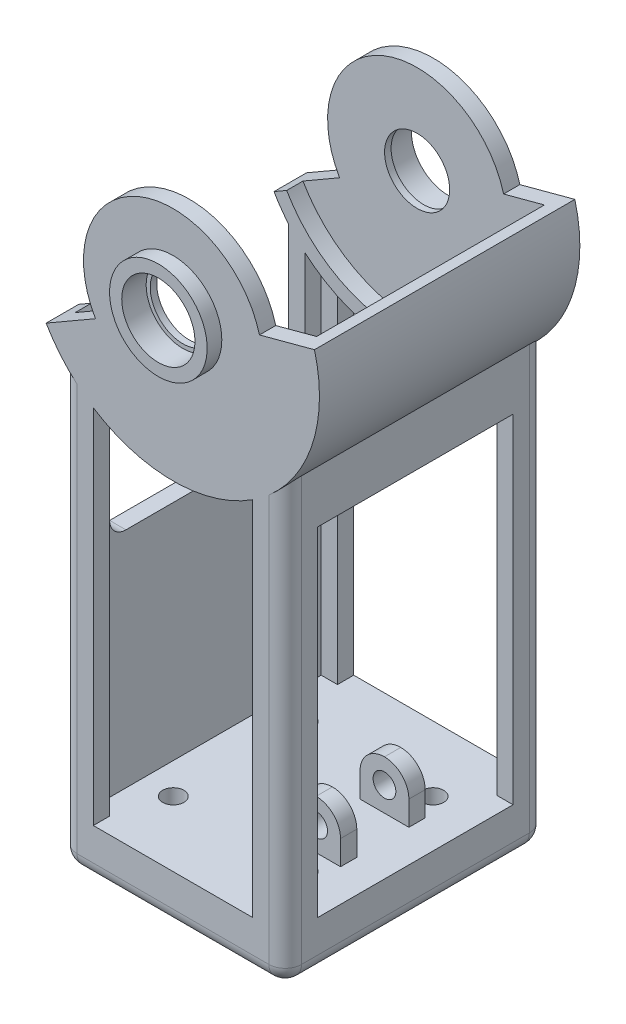
from build123d import *

# Parameters (mm, degrees)
SKETCH1_R               = 45
BOSS_EXTRUDE1_DEPTH     = 80
SKETCH2_W               = 68.94399988
SKETCH2_H               = 120
BOSS_EXTRUDE2_DEPTH     = 80
CUT_EXTRUDE1_START      = -70
SKETCH3_R               = 40.5
CUT_EXTRUDE1_DEPTH      = 70
CUT_EXTRUDE2_REACH      = 176.939
SKETCH4_R               = 10
CUT_EXTRUDE3_REACH      = 176.939
CUT_EXTRUDE4_REACH      = 200.874
CUT_EXTRUDE4_END_RADIUS = 45
SKETCH6_W               = 58.94399988
SKETCH6_H               = 70
CUT_EXTRUDE5_REACH      = 200.874
CUT_EXTRUDE5_END_RADIUS = 45
SKETCH7_W               = 48.94399988
SKETCH7_H               = 5
CUT_EXTRUDE6_START      = -103.925442
SKETCH8_W               = 5
SKETCH8_H               = 60
CUT_EXTRUDE6_DEPTH      = 103.925442
SKETCH9_W               = 65
SKETCH9_H               = 60
CUT_EXTRUDE7_DEPTH      = 60
SKETCH11_W              = 68.94399988
SKETCH11_H              = 80
BOSS_EXTRUDE3_DEPTH     = 15
SKETCH12_W              = 15
SKETCH12_H              = 5
BOSS_EXTRUDE4_DEPTH     = 15
FILLET1_R               = 7.5
CUT_EXTRUDE8_REACH      = 180.061
SKETCH13_R              = 3.5
FILLET2_R               = 5
FILLET3_R               = 5
SKETCH15_R              = 15
BOSS_EXTRUDE5_DEPTH     = 4.5
SKETCH16_R              = 11.25
CUT_EXTRUDE9_DEPTH      = 7.5
SKETCH17_R              = 3.25
CUT_EXTRUDE10_DEPTH     = 15


with BuildPart() as part:
    # Sketch1 → Boss-Extrude1 (new body)
    with BuildSketch(Plane.XY):
        Circle(SKETCH1_R)
    extrude(amount=BOSS_EXTRUDE1_DEPTH)

    # Sketch2 → Boss-Extrude2 (add)
    with BuildSketch(Plane(origin=(0, 0, 0), x_dir=(-1, 0, 0), z_dir=(0, 0, -1))):
        with Locations((0, -88.925442436)):
            Rectangle(SKETCH2_W, SKETCH2_H)
    extrude(amount=-BOSS_EXTRUDE2_DEPTH)

    # Sketch3 → Cut-Extrude1 (cut)
    with BuildSketch(Plane(origin=(0, 0, 5), x_dir=(-1, 0, 0), z_dir=(0, 0, -1)).offset(CUT_EXTRUDE1_START)):
        Circle(SKETCH3_R)
    extrude(amount=CUT_EXTRUDE1_DEPTH, mode=Mode.SUBTRACT)

    # Cut-Extrude2: up to this face of the body (flat: up to its plane)
    cut_extrude2_end = Plane(part.part.faces().sort_by_distance((0, -51.092470511, 80))[0])
    # Sketch4 → Cut-Extrude2 (cut, up to the picked face)
    with BuildSketch(Plane(origin=(0, 0, 0), x_dir=(-1, 0, 0), z_dir=(0, 0, -1)), mode=Mode.PRIVATE) as cut_extrude2_sk1:
        Circle(SKETCH4_R)
    cut_extrude2_tool1 = split(extrude(cut_extrude2_sk1.sketch, amount=-CUT_EXTRUDE2_REACH, mode=Mode.PRIVATE), bisect_by=cut_extrude2_end, keep=Keep.BOTH, mode=Mode.PRIVATE)
    add(cut_extrude2_tool1.solids().sort_by(Axis((0, 0, 0), (0, 0, 1)))[0], mode=Mode.SUBTRACT)

    # Cut-Extrude3: up to this face of the body (flat: up to its plane)
    cut_extrude3_end = Plane(part.part.faces().sort_by_distance((0, -52.276987432, 80))[0])
    # Sketch5 → Cut-Extrude3 (cut, up to the picked face)
    with BuildSketch(Plane(origin=(0, 0, 0), x_dir=(-1, 0, 0), z_dir=(0, 0, -1)), mode=Mode.PRIVATE) as cut_extrude3_sk1:
        with BuildLine():
            Line((-26.562960223, 7.11752374), (-43.466662183, 11.64685703))
            ThreePointArc((-43.466662183, 11.64685703), (17.220754456, 41.574578963), (38.97114317, -22.5))
            Line((38.97114317, -22.5), (23.815698604, -13.75))
            ThreePointArc((23.815698604, -13.75), (10.52379439, 25.406687144), (-26.562960223, 7.11752374))
        make_face()
    cut_extrude3_tool1 = split(extrude(cut_extrude3_sk1.sketch, amount=-CUT_EXTRUDE3_REACH, mode=Mode.PRIVATE), bisect_by=cut_extrude3_end, keep=Keep.BOTH, mode=Mode.PRIVATE)
    add(cut_extrude3_tool1.solids().sort_by(Axis((-31.949807, -17.161312, 0), (0, 0, 1)))[0], mode=Mode.SUBTRACT)

    # Cut-Extrude4: up to this cylinder (the profile starts outside it)
    cut_extrude4_end = Plane(origin=(0, 0, 40), z_dir=(0, 0, -1)) * Cylinder(CUT_EXTRUDE4_END_RADIUS, 492.748, mode=Mode.PRIVATE)
    # Sketch6 → Cut-Extrude4 (cut, up to the surface)
    with BuildSketch(Plane.XZ.offset(148.925442436), mode=Mode.PRIVATE) as cut_extrude4_sk1:
        with Locations((0, 40)):
            Rectangle(SKETCH6_W, SKETCH6_H)
    cut_extrude4_tool1 = extrude(cut_extrude4_sk1.sketch, amount=-CUT_EXTRUDE4_REACH, mode=Mode.PRIVATE) - cut_extrude4_end
    add(cut_extrude4_tool1.solids().sort_by_distance((0, -148.925442, 40))[0], mode=Mode.SUBTRACT)

    # Cut-Extrude5: up to this cylinder (the profile starts outside it)
    cut_extrude5_end = Plane(origin=(0, 0, 40), z_dir=(0, 0, -1)) * Cylinder(CUT_EXTRUDE5_END_RADIUS, 567.748, mode=Mode.PRIVATE)
    # Sketch7 → Cut-Extrude5 (cut, up to the surface)
    with BuildSketch(Plane.XZ.offset(148.925442436), mode=Mode.PRIVATE) as cut_extrude5_sk1:
        with Locations((0, 77.5)):
            Rectangle(SKETCH7_W, SKETCH7_H)
    cut_extrude5_tool1 = extrude(cut_extrude5_sk1.sketch, amount=-CUT_EXTRUDE5_REACH, mode=Mode.PRIVATE) - cut_extrude5_end
    add(cut_extrude5_tool1.solids().sort_by_distance((0, -148.925442, 77.5))[0], mode=Mode.SUBTRACT)
    # Sketch7 → Cut-Extrude5 (cut, up to the surface)
    with BuildSketch(Plane.XZ.offset(148.925442436), mode=Mode.PRIVATE) as cut_extrude5_sk2:
        with Locations((0, 2.5)):
            Rectangle(SKETCH7_W, SKETCH7_H)
    cut_extrude5_tool2 = extrude(cut_extrude5_sk2.sketch, amount=-CUT_EXTRUDE5_REACH, mode=Mode.PRIVATE) - cut_extrude5_end
    add(cut_extrude5_tool2.solids().sort_by_distance((0, -148.925442, 2.5))[0], mode=Mode.SUBTRACT)

    # Sketch8 → Cut-Extrude6 (cut)
    with BuildSketch(Plane.XZ.offset(148.925442436).offset(CUT_EXTRUDE6_START)):
        with Locations((31.97199994, 40)):
            Rectangle(SKETCH8_W, SKETCH8_H)
    extrude(amount=CUT_EXTRUDE6_DEPTH, mode=Mode.SUBTRACT)

    # Sketch9 → Cut-Extrude7 (cut)
    with BuildSketch(Plane(origin=(0, -20.25, 0), x_dir=(1, 0, 0), z_dir=(0, 1, 0))):
        with Locations((-6.47114317, -40)):
            Rectangle(SKETCH9_W, SKETCH9_H)
    extrude(amount=-CUT_EXTRUDE7_DEPTH, mode=Mode.SUBTRACT)

    # Sketch11 → Boss-Extrude3 (add)
    with BuildSketch(Plane.XZ.offset(148.925442436)):
        with Locations((0, 40)):
            Rectangle(SKETCH11_W, SKETCH11_H)
    extrude(amount=BOSS_EXTRUDE3_DEPTH)

    # Sketch12 → Boss-Extrude4 (add)
    with BuildSketch(Plane(origin=(0, -148.925442436, 0), x_dir=(1, 0, 0), z_dir=(0, 1, 0))):
        with Locations((16.97199994, -29.5)):
            Rectangle(SKETCH12_W, SKETCH12_H)
        with Locations((16.97199994, -50.5)):
            Rectangle(SKETCH12_W, SKETCH12_H)
    extrude(amount=BOSS_EXTRUDE4_DEPTH)

    # Fillet1
    fillet1_edges = [part.edges().sort_by_distance(p)[0] for p in [
        (24.47199994, -133.925442436, 50.5),
        (9.47199994, -133.925442436, 50.5),
        (24.47199994, -133.925442436, 29.5),
        (9.47199994, -133.925442436, 29.5),
    ]]
    fillet(fillet1_edges, radius=FILLET1_R - 0.0001)  # a hair under: the kernel refuses the full size

    # Cut-Extrude8: up to this face of the body (flat: up to its plane)
    cut_extrude8_end = Plane(part.part.faces().sort_by_distance((16.97199994, -142.125548149, 53))[0])
    # Sketch13 → Cut-Extrude8 (cut, up to the picked face)
    with BuildSketch(Plane(origin=(0, 0, 27), x_dir=(-1, 0, 0), z_dir=(0, 0, -1)), mode=Mode.PRIVATE) as cut_extrude8_sk1:
        with Locations((-16.97199994, -141.425442436)):
            Circle(SKETCH13_R)
    cut_extrude8_tool1 = split(extrude(cut_extrude8_sk1.sketch, amount=-CUT_EXTRUDE8_REACH, mode=Mode.PRIVATE), bisect_by=cut_extrude8_end, keep=Keep.BOTH, mode=Mode.PRIVATE)
    add(cut_extrude8_tool1.solids().sort_by(Axis((16.972, -141.425442, 27), (0, 0, 1)))[0], mode=Mode.SUBTRACT)

    # Fillet2
    fillet2_edges = [part.edges().sort_by_distance(p)[0] for p in [
        (34.47199994, -96.425442436, 0),
        (-34.47199994, -96.425442436, 0),
        (34.47199994, -96.425442436, 80),
        (-34.47199994, -96.425442436, 80),
        (-34.47199994, -163.925442436, 40),
        (0, -163.925442436, 0),
        (34.47199994, -163.925442436, 40),
        (0, -163.925442436, 80),
    ]]
    fillet(fillet2_edges, radius=FILLET2_R)

    # Fillet3
    fillet3_edges = [part.edges().sort_by_distance(p)[0] for p in [
        (26.02885683, -33.868240693, 10),
        (-31.97199994, -80.25, 10),
        (-31.97199994, -80.25, 70),
        (26.02885683, -33.868240693, 70),
    ]]
    fillet(fillet3_edges, radius=FILLET3_R)

    # Sketch15 → Boss-Extrude5 (add)
    with BuildSketch(Plane(origin=(0, 0, 0), x_dir=(-1, 0, 0), z_dir=(0, 0, -1))):
        with Locations(Location((0, 0, 0), (0, 0, 180))):
            Circle(SKETCH15_R)
    boss_extrude5 = extrude(amount=BOSS_EXTRUDE5_DEPTH)

    # Mirror1: Boss-Extrude5 across plane
    add(boss_extrude5.mirror(Plane.XY.offset(40)))

    # Sketch16 → Cut-Extrude9 (cut)
    with BuildSketch(Plane(origin=(0, 0, -4.5), x_dir=(-1, 0, 0), z_dir=(0, 0, -1))):
        Circle(SKETCH16_R)
    cut_extrude9 = extrude(amount=-CUT_EXTRUDE9_DEPTH, mode=Mode.SUBTRACT)

    # Mirror2: Cut-Extrude9 across plane
    add(cut_extrude9.mirror(Plane.XY.offset(40)), mode=Mode.SUBTRACT)

    # Sketch17 → Cut-Extrude10 (cut)
    with BuildSketch(Plane.XZ.offset(163.925442436)):
        with Locations(Location((-19.955, 59.955, 0), (0, 0, 270))):
            Circle(SKETCH17_R)
        with Locations(Location((19.955, 59.955, 0), (0, 0, 270))):
            Circle(SKETCH17_R)
        with Locations(Location((19.955, 20.045, 0), (0, 0, 270))):
            Circle(SKETCH17_R)
        with Locations(Location((-19.955, 20.045, 0), (0, 0, 270))):
            Circle(SKETCH17_R)
    extrude(amount=-CUT_EXTRUDE10_DEPTH, mode=Mode.SUBTRACT)


solid = part.part
